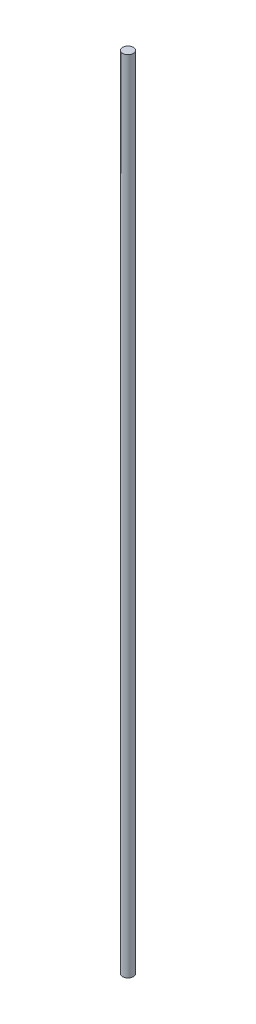
from build123d import *

# Parameters (mm, degrees)
SKETCH1_R           = 8
BOSS_EXTRUDE1_DEPTH = 1200


with BuildPart() as part:
    # Sketch1 → Boss-Extrude1 (new body)
    with BuildSketch(Plane(origin=(0, 0, 0), x_dir=(1, 0, 0), z_dir=(0, 1, 0))):
        Circle(SKETCH1_R)
    extrude(amount=BOSS_EXTRUDE1_DEPTH)


solid = part.part
